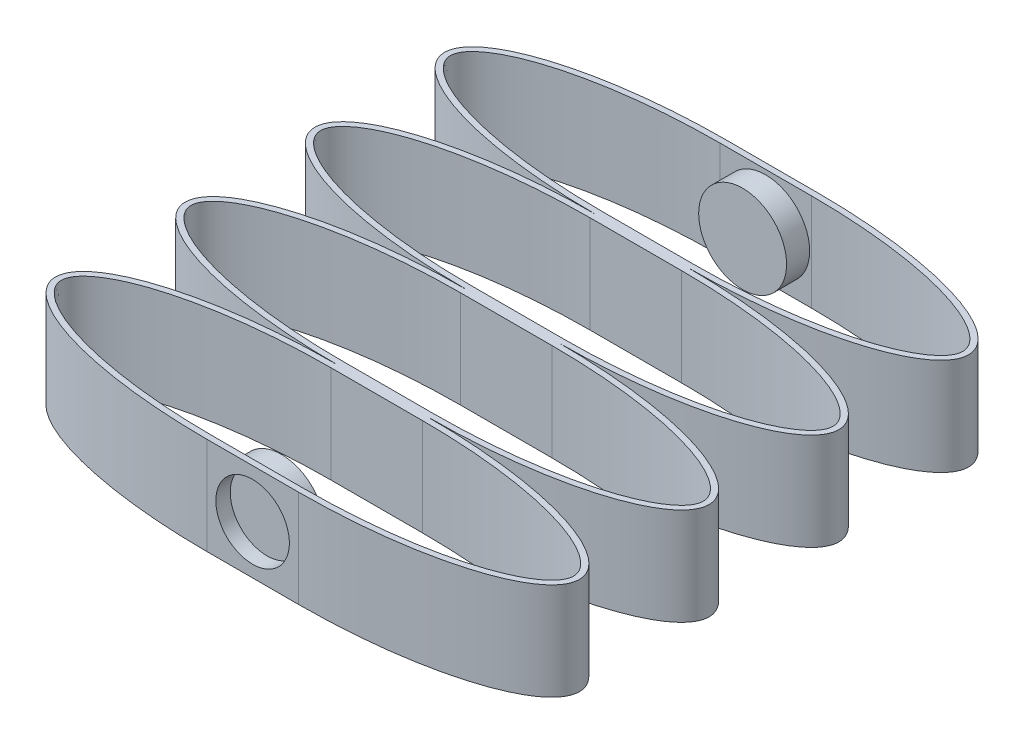
from build123d import *

# Parameters (mm, degrees)
EXTRUDE_THIN1_START = -6.75
EXTRUDE_THIN1_DEPTH = 13.5
SKETCH2_R           = 6.1
BOSS_EXTRUDE1_DEPTH = 4
SKETCH5_R           = 5.1
CUT_EXTRUDE1_DEPTH  = 2
LPATTERN2_COUNT     = 2
LPATTERN2_PITCH     = 18


# Read off the part's stored shape, not the designer's step: Extrude-Thin1
with BuildPart() as part:
    # Extrude-Thin1 outline → Extrude-Thin1 (new body)
    with BuildSketch(Plane(origin=(0, 0, 0), x_dir=(1, 0, 0), z_dir=(0, 1, 0)).offset(EXTRUDE_THIN1_START)):
        with BuildLine():
            Line((6.35, 9), (-6.35, 9))
            add(Edge.make_bspline(
                [(-6.35, 9), (-36.35, 9), (-36.35, 0), (-36.35, -9), (-6.35, -9)],
                knots=[4.71238898, 4.71238898, 4.71238898, 6.283185307, 6.283185307, 7.853981634, 7.853981634, 7.853981634], degree=2, weights=[1, 0.707106781, 1, 0.707106781, 1]))
            Line((-6.35, -9), (6.35, -9))
            add(Edge.make_bspline(
                [(6.35, -9), (36.35, -9), (36.35, 0), (36.35, 9), (6.35, 9)],
                knots=[4.71238898, 4.71238898, 4.71238898, 6.283185307, 6.283185307, 7.853981634, 7.853981634, 7.853981634], degree=2, weights=[1, 0.707106781, 1, 0.707106781, 1]))
        make_face()
        with BuildLine():
            add(Edge.make_bspline(
                [(-6.35, 8.2), (-8.992427353, 8.2), (-11.626551597, 8.09645081), (-15.564099643, 7.771041688), (-16.874316019, 7.633892852), (-19.489464233, 7.293691024), (-20.796171896, 7.090470499), (-23.394104361, 6.603677281), (-24.683995522, 6.320910164), (-27.238719343, 5.646664272), (-28.505721797, 5.255657689), (-30.347037327, 4.54620503), (-30.951719549, 4.288780232), (-32.13450279, 3.712693132), (-32.713379386, 3.395051542), (-33.546231029, 2.839205601), (-33.814841817, 2.642358721), (-34.326150909, 2.215391473), (-34.569673931, 1.984514884), (-34.894222949, 1.608624418), (-34.995887896, 1.478084784), (-35.181813578, 1.20300641), (-35.266792206, 1.056993155), (-35.407682989, 0.753754356), (-35.46377233, 0.596839755), (-35.537944701, 0.268991999), (-35.554499981, 0.101929686), (-35.543352504, -0.229689092), (-35.515124593, -0.397623888), (-35.421862612, -0.718694513), (-35.357054485, -0.873886559), (-35.123926474, -1.320299918), (-34.923673151, -1.585238293), (-34.473991766, -2.079281932), (-34.226721907, -2.30410327), (-33.711710669, -2.719957094), (-33.442297806, -2.912105224), (-32.886707927, -3.274186609), (-32.59948498, -3.44449741), (-32.018409735, -3.764513242), (-31.724201576, -3.914496488), (-30.833068539, -4.341208323), (-30.227757927, -4.595034475), (-28.388932387, -5.293987493), (-27.132894438, -5.677601301), (-25.221165192, -6.177445596), (-24.578409561, -6.331058881), (-23.292136717, -6.614443617), (-22.647771048, -6.7444423), (-19.420659469, -7.344176915), (-16.822592015, -7.668160728), (-11.60344529, -8.097219542), (-8.982124815, -8.2), (-6.35, -8.2)],
                knots=[0, 0, 0, 0, 0.125, 0.125, 0.1875, 0.1875, 0.25, 0.25, 0.3125, 0.3125, 0.375, 0.375, 0.40625, 0.40625, 0.4375, 0.4375, 0.453125, 0.453125, 0.46875, 0.46875, 0.4765625, 0.4765625, 0.484375, 0.484375, 0.4921875, 0.4921875, 0.5, 0.5, 0.5078125, 0.5078125, 0.515625, 0.515625, 0.53125, 0.53125, 0.546875, 0.546875, 0.5625, 0.5625, 0.578125, 0.578125, 0.59375, 0.59375, 0.625, 0.625, 0.6875, 0.6875, 0.71875, 0.71875, 0.75, 0.75, 0.875, 0.875, 1, 1, 1, 1], degree=3))
            Line((-6.35, 8.2), (6.35, 8.2))
            add(Edge.make_bspline(
                [(6.35, -8.2), (8.992427353, -8.2), (11.626551597, -8.09645081), (15.564099643, -7.771041688), (16.874316019, -7.633892852), (19.489464233, -7.293691024), (20.796171896, -7.090470499), (23.394104361, -6.603677281), (24.683995522, -6.320910164), (27.238719343, -5.646664272), (28.505721797, -5.255657689), (30.347037327, -4.54620503), (30.951719549, -4.288780232), (32.13450279, -3.712693132), (32.713379386, -3.395051542), (33.546231029, -2.839205601), (33.814841817, -2.642358721), (34.326150909, -2.215391473), (34.569673931, -1.984514884), (34.894222949, -1.608624418), (34.995887896, -1.478084784), (35.181813578, -1.20300641), (35.266792206, -1.056993155), (35.407682989, -0.753754356), (35.46377233, -0.596839755), (35.537944701, -0.268991999), (35.554499981, -0.101929686), (35.543352504, 0.229689092), (35.515124593, 0.397623888), (35.421862612, 0.718694513), (35.357054485, 0.873886559), (35.123926474, 1.320299918), (34.923673151, 1.585238293), (34.473991766, 2.079281932), (34.226721907, 2.30410327), (33.711710669, 2.719957094), (33.442297806, 2.912105224), (32.886707927, 3.274186609), (32.59948498, 3.44449741), (32.018409735, 3.764513242), (31.724201576, 3.914496488), (30.833068539, 4.341208323), (30.227757927, 4.595034475), (28.388932387, 5.293987493), (27.132894438, 5.677601301), (25.221165192, 6.177445596), (24.578409561, 6.331058881), (23.292136717, 6.614443617), (22.647771048, 6.7444423), (19.420659469, 7.344176915), (16.822592015, 7.668160728), (11.60344529, 8.097219542), (8.982124815, 8.2), (6.35, 8.2)],
                knots=[0, 0, 0, 0, 0.125, 0.125, 0.1875, 0.1875, 0.25, 0.25, 0.3125, 0.3125, 0.375, 0.375, 0.40625, 0.40625, 0.4375, 0.4375, 0.453125, 0.453125, 0.46875, 0.46875, 0.4765625, 0.4765625, 0.484375, 0.484375, 0.4921875, 0.4921875, 0.5, 0.5, 0.5078125, 0.5078125, 0.515625, 0.515625, 0.53125, 0.53125, 0.546875, 0.546875, 0.5625, 0.5625, 0.578125, 0.578125, 0.59375, 0.59375, 0.625, 0.625, 0.6875, 0.6875, 0.71875, 0.71875, 0.75, 0.75, 0.875, 0.875, 1, 1, 1, 1], degree=3))
            Line((6.35, -8.2), (-6.35, -8.2))
        make_face(mode=Mode.SUBTRACT)
    extrude_thin1 = extrude(amount=EXTRUDE_THIN1_DEPTH)

    # Sketch2 → Boss-Extrude1 (add)
    with BuildSketch(Plane(origin=(0, 0, -9), x_dir=(-1, 0, 0), z_dir=(0, 0, -1))):
        Circle(SKETCH2_R)
    extrude(amount=-BOSS_EXTRUDE1_DEPTH)

    # Sketch5 → Cut-Extrude1 (cut)
    with BuildSketch(Plane(origin=(0, 0, -9), x_dir=(-1, 0, 0), z_dir=(0, 0, -1))):
        Circle(SKETCH5_R)
    extrude(amount=-CUT_EXTRUDE1_DEPTH, mode=Mode.SUBTRACT)

    # LPattern2: Extrude-Thin1 ×2
    with Locations(*[(0, 0, i * LPATTERN2_PITCH) for i in range(1, LPATTERN2_COUNT)]):
        add(extrude_thin1)

    # Mirror5: part across plane


with BuildPart() as part_1:
    add(part.part)
    add(part.part.mirror(Plane(origin=(-6.35, 6.75, 27), x_dir=(1, 0, 0), z_dir=(0, 0, -1))))


solid = part_1.part
